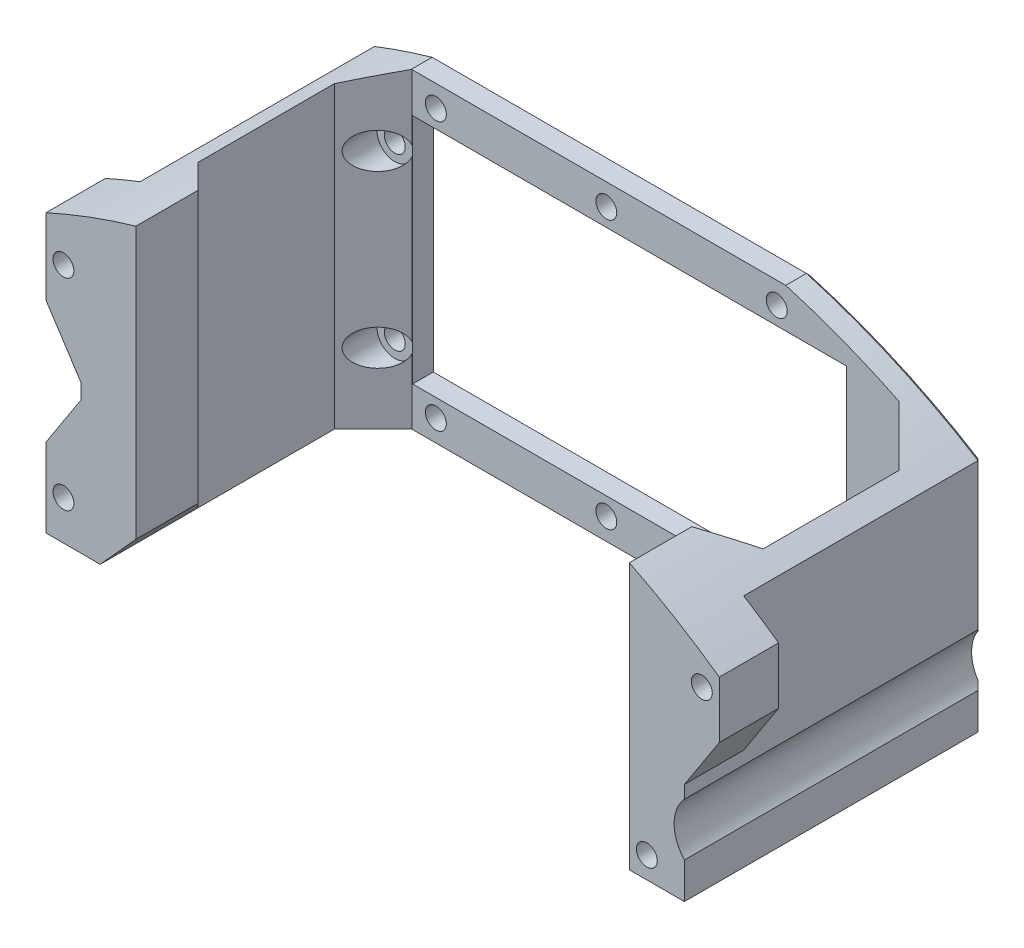
from build123d import *

# Parameters (mm, degrees)
SKETCH1_R           = 1.35
SKETCH1_W           = 56
SKETCH1_H           = 30
BOSS_EXTRUDE1_DEPTH = 3.175
SKETCH2_W           = 2.5
SKETCH2_H           = 40.2
SKETCH2_H_2         = 35.1
BOSS_EXTRUDE2_DEPTH = 27.57
SKETCH3_R           = 1.35
BOSS_EXTRUDE3_DEPTH = 3
CHAMFER1_SIZE       = 0.5
CHAMFER3_SIZE       = 5
SKETCH5_R           = 2.3
CUT_EXTRUDE2_DEPTH  = 7
CHAMFER4_SIZE       = 0.5
CUT_EXTRUDE3_DEPTH  = 33.745
CHAMFER5_SIZE       = 0.5
CHAMFER6_SIZE       = 5
CHAMFER7_SIZE       = 4.545853152
CHAMFER7_SIZE_2     = 7
SKETCH7_R           = 5
CUT_EXTRUDE4_DEPTH  = 64.425350019
CHAMFER8_SIZE       = 7
CHAMFER8_SIZE_2     = 4.545853152
SKETCH9_R           = 2.35
CUT_EXTRUDE5_DEPTH  = 30.745
SKETCH10_R          = 1.35
BOSS_EXTRUDE4_DEPTH = 4.65


# Read off the part's stored shape, not the designer's step: Cut-Extrude3
with BuildPart() as part:
    # Sketch1 → Boss-Extrude1 (new body)
    with BuildSketch(Plane.XY):
        Polygon((33.5, 20.1), (45.3, 15), (45.3, -20.1), (-32.6, -20.1), (-32.6, 20.1), align=None)
        with Locations((22, 17.3)):
            Circle(SKETCH1_R, mode=Mode.SUBTRACT)
        with Locations((0, 17.3)):
            Circle(SKETCH1_R, mode=Mode.SUBTRACT)
        with Locations((-22, 17.3)):
            Circle(SKETCH1_R, mode=Mode.SUBTRACT)
        with Locations((-27.3, 11)):
            Circle(SKETCH1_R, mode=Mode.SUBTRACT)
        with Locations(Location((22, -17.3, 0), (0, 0, 180))):
            Circle(SKETCH1_R, mode=Mode.SUBTRACT)
        with Locations(Location((0, -17.3, 0), (0, 0, 180))):
            Circle(SKETCH1_R, mode=Mode.SUBTRACT)
        with Locations(Location((-22, -17.3, 0), (0, 0, 180))):
            Circle(SKETCH1_R, mode=Mode.SUBTRACT)
        with Locations(Location((-27.3, -11, 0), (0, 0, 180))):
            Circle(SKETCH1_R, mode=Mode.SUBTRACT)
        with Locations((3, 0)):
            Rectangle(SKETCH1_W, SKETCH1_H, mode=Mode.SUBTRACT)
    extrude(amount=BOSS_EXTRUDE1_DEPTH)

    # Sketch2 → Boss-Extrude2 (add)
    with BuildSketch(Plane.XY.offset(3.175)):
        with Locations((-31.35, 0)):
            Rectangle(SKETCH2_W, SKETCH2_H)
        with Locations((44.05, -2.55)):
            Rectangle(SKETCH2_W, SKETCH2_H_2)
    extrude(amount=BOSS_EXTRUDE2_DEPTH)

    # Sketch3 → Boss-Extrude3 (add)
    # profile 1 of 2: a face of its own
    with BuildSketch(Plane.XY.offset(30.745)):
        Polygon((49.8, 0), (45.3, 0), (45.3, -20.1), (38.2, -20.1), (38.2, 15), (49.8, 15), align=None)
        with Locations((47.55, 5)):
            Circle(SKETCH3_R, mode=Mode.SUBTRACT)
        with Locations((40.45, -17.3)):
            Circle(SKETCH3_R, mode=Mode.SUBTRACT)
    # profile 2 of 2: a face of its own
    with BuildSketch(Plane.XY.offset(30.745)):
        Polygon((-25.5, 20.1), (-37.1, 20.1), (-37.1, 6), (-32.6, 6), (-32.6, -10), (-37.1, -10), (-37.1, -20.1), (-30.1, -20.1), (-25.5, -15), align=None)
        with Locations((-34.85, 11)):
            Circle(SKETCH3_R, mode=Mode.SUBTRACT)
        with Locations((-34.85, -15)):
            Circle(SKETCH3_R, mode=Mode.SUBTRACT)
    extrude(amount=BOSS_EXTRUDE3_DEPTH)

    # Chamfer1
    chamfer1_edges = [part.edges().sort_by_distance(p)[0] for p in [
        (3, -15, 0),
        (31, 0, 0),
        (3, 15, 0),
        (-25, 0, 0),
    ]]
    chamfer(chamfer1_edges, length=CHAMFER1_SIZE)

    # Chamfer3
    # the kernel refuses this chamfer: 5 mm, written as the material it adds along each edge
    with BuildSketch(Plane(origin=(-30.1, 20.1, 3.175), x_dir=(0.9996219169112968, 0, -0.027495876610586386), z_dir=(0, -1, 0))) as chamfer3_piece_1_section:
        Polygon((CHAMFER3_SIZE * 0.999621916911, CHAMFER3_SIZE * 0.0274958766106), (-CHAMFER3_SIZE * 0.0274958766106, CHAMFER3_SIZE * 0.999621916911), (0, 0), align=None)
    chamfer3_piece_1 = extrude(amount=40.2, mode=Mode.PRIVATE)
    chamfer3_piece_1 = chamfer3_piece_1 - Plane(origin=(-27.3, -11, 4.84942863), x_dir=(-1, 0, 0), z_dir=(0, 0, -1)) * Cylinder(1.35, 101, mode=Mode.PRIVATE)
    chamfer3_piece_1 = chamfer3_piece_1 - Plane(origin=(-27.3, 11, 4.84942863), x_dir=(1, 0, 0), z_dir=(0, 0, -1)) * Cylinder(1.35, 101, mode=Mode.PRIVATE)
    add(chamfer3_piece_1)
    with BuildSketch(Plane(origin=(42.8, 15, 3.175), x_dir=(-0.9996219169112968, 0, -0.027495876610586403), z_dir=(0, -1, 0))) as chamfer3_piece_2:
        Polygon((CHAMFER3_SIZE * 0.999621916911, -CHAMFER3_SIZE * 0.0274958766106), (-CHAMFER3_SIZE * 0.0274958766106, -CHAMFER3_SIZE * 0.999621916911), (0, 0), align=None)
    extrude(amount=35.1)

    # Sketch5 → Cut-Extrude2 (cut)
    with BuildSketch(Plane.XY.offset(3.175)):
        with Locations((-27.3, 11)):
            Circle(SKETCH5_R)
        with Locations((-27.3, -11)):
            Circle(SKETCH5_R)
    extrude(amount=CUT_EXTRUDE2_DEPTH, mode=Mode.SUBTRACT)

    # Chamfer4
    chamfer4_edges = [part.edges().sort_by_distance(p)[0] for p in [
        (41.55, 15, 3.175),
    ]]
    chamfer(chamfer4_edges, length=CHAMFER4_SIZE)

    # Cut-Extrude3 outline → Cut-Extrude3 (cut)
    with BuildSketch(Plane.XY):
        with BuildLine():
            Line((33.5, 20.1), (23.154502686, 20.1))
            ThreePointArc((23.154502686, 20.1), (37.024570378, 14.805977232), (49.8, 7.243315476))
            Line((49.8, 7.243315476), (49.8, 15))
            Line((49.8, 15), (45.3, 15))
            Line((45.3, 15), (33.5, 20.1))
        make_face()
        with BuildLine():
            ThreePointArc((-37.1, 15.705959627), (-31.207253619, 18.120471436), (-25.154502686, 20.1))
            Line((-25.154502686, 20.1), (-37.1, 20.1))
            Line((-37.1, 20.1), (-37.1, 15.705959627))
        make_face()
    extrude(amount=CUT_EXTRUDE3_DEPTH, mode=Mode.SUBTRACT)

    # Chamfer5
    chamfer5_edges = [part.edges().sort_by_distance(p)[0] for p in [
        (-1, 20.1, 0),
        (-32.6, -1.252665528, 0),
        (34.570093208, 15.943845724, 0),
        (-28.905381441, 18.930933232, 0),
        (45.3, -4.926691958, 0),
    ]]
    chamfer(chamfer5_edges, length=CHAMFER5_SIZE)

    # Chamfer6
    # the kernel refuses this chamfer: 5 mm, written as the material it adds along each edge
    with BuildSketch(Plane(origin=(-30.1, 31.377746009, 30.745), x_dir=(-0.027495876610586317, 0, -0.9996219169112968), z_dir=(0, -1, 0))) as chamfer6_piece_1_section:
        Polygon((CHAMFER6_SIZE * 0.999621916911, CHAMFER6_SIZE * 0.0274958766106), (-CHAMFER6_SIZE * 0.0274958766106, CHAMFER6_SIZE * 0.999621916911), (0, 0), align=None)
    chamfer6_piece_1 = extrude(amount=51.477746009, mode=Mode.PRIVATE)
    chamfer6_piece_1 = split(chamfer6_piece_1, bisect_by=Plane(origin=(-19.223588123, -8.041369441, 29.056632275), z_dir=(-0.7425697235686511, 0.6697687702776064, 0)), keep=Keep.TOP, mode=Mode.PRIVATE)
    chamfer6_piece_1 = chamfer6_piece_1 & Plane(origin=(-1.000000031, -63.999999922, 29.056632275), x_dir=(-0.4125714286119157, 0.9109252528572929, 0), z_dir=(0, 0, -1)) * Cylinder(87.499999916, 123, mode=Mode.PRIVATE)
    chamfer6_piece_1 = split(chamfer6_piece_1, bisect_by=Plane(origin=(-25.5, 0.348686726, 29.056632275), z_dir=(-1, 0, 0)), keep=Keep.TOP, mode=Mode.PRIVATE)
    add(chamfer6_piece_1)
    with BuildSketch(Plane(origin=(42.8, 24.606748254, 30.745), x_dir=(-0.9996219169112968, 0, 0.027495876610586317), z_dir=(0, -1, 0))) as chamfer6_piece_2_section:
        Polygon((CHAMFER6_SIZE * 0.999621916911, CHAMFER6_SIZE * 0.0274958766106), (-CHAMFER6_SIZE * 0.0274958766106, CHAMFER6_SIZE * 0.999621916911), (0, 0), align=None)
    chamfer6_piece_2 = extrude(amount=44.706748254, mode=Mode.PRIVATE)
    chamfer6_piece_2 = split(chamfer6_piece_2, bisect_by=Plane(origin=(38.2, -3.223741297, 29.074949458), z_dir=(1, 0, 0)), keep=Keep.TOP, mode=Mode.PRIVATE)
    chamfer6_piece_2 = chamfer6_piece_2 & Plane(origin=(-1.000000015, -64.000000032, 29.074949458), x_dir=(0.2760514593327394, 0.9611428571238851, 0), z_dir=(0, 0, -1)) * Cylinder(87.500000035, 110, mode=Mode.PRIVATE)
    chamfer6_piece_2 = chamfer6_piece_2 - Plane(origin=(40.45, -17.3, 29.074949458), x_dir=(1, 0, 0), z_dir=(0, 0, -1)) * Cylinder(1.35, 110, mode=Mode.PRIVATE)
    add(chamfer6_piece_2)

    # Chamfer7
    # the kernel refuses this chamfer: 7, 4.545853152 mm, written as the material it adds along each edge
    with BuildSketch(Plane(origin=(45.3, 0, 30.745), x_dir=(0.9987532912567346, 0.049918565722988334, 0), z_dir=(0, 0, 1))) as chamfer7_piece_1_section:
        Polygon((CHAMFER7_SIZE * 0.998753291341, -CHAMFER7_SIZE * 0.0499185657272), (-CHAMFER7_SIZE_2 * 0.049918565723, -CHAMFER7_SIZE_2 * 0.998753291257), (0, 0), align=None)
    chamfer7_piece_1 = extrude(amount=3, mode=Mode.PRIVATE)
    chamfer7_piece_1 = split(chamfer7_piece_1, bisect_by=Plane(origin=(49.8, -2.345805882, 32.245), z_dir=(-1, 0, 0)), keep=Keep.TOP, mode=Mode.PRIVATE)
    add(chamfer7_piece_1)

    # Sketch7 → Cut-Extrude4 (cut, through all)
    with BuildSketch(Plane(origin=(0, 0, 0), x_dir=(-1, 0, 0), z_dir=(0, 0, -1))):
        with Locations((-48.97, -12.05)):
            Circle(SKETCH7_R)
    extrude(amount=-CUT_EXTRUDE4_DEPTH, mode=Mode.SUBTRACT)

    # Chamfer8
    # the kernel refuses this chamfer: 7, 4.545853152 mm, written as the material it adds along each edge
    with BuildSketch(Plane(origin=(-32.6, -10, 30.745), x_dir=(0.02107376546627368, 0.9997779235455605, 0), z_dir=(0, 0, 1))) as chamfer8_piece_1_section:
        Polygon((CHAMFER8_SIZE * 0.999777923546, CHAMFER8_SIZE * 0.0210737654663), (-CHAMFER8_SIZE_2 * 0.021073765468, CHAMFER8_SIZE_2 * 0.99977792363), (0, 0), align=None)
    chamfer8_piece_1 = extrude(amount=3, mode=Mode.PRIVATE)
    chamfer8_piece_1 = split(chamfer8_piece_1, bisect_by=Plane(origin=(-37.1, -7.654194118, 32.245), z_dir=(1, 0, 0)), keep=Keep.TOP, mode=Mode.PRIVATE)
    add(chamfer8_piece_1)
    with BuildSketch(Plane(origin=(-32.6, 6, 30.745), x_dir=(-0.9987532912567346, 0.049918565722988396, 0), z_dir=(0, 0, 1))) as chamfer8_piece_2_section:
        Polygon((CHAMFER8_SIZE_2 * 0.998753291341, CHAMFER8_SIZE_2 * 0.0499185657272), (-CHAMFER8_SIZE * 0.049918565723, CHAMFER8_SIZE * 0.998753291257), (0, 0), align=None)
    chamfer8_piece_2 = extrude(amount=3, mode=Mode.PRIVATE)
    chamfer8_piece_2 = split(chamfer8_piece_2, bisect_by=Plane(origin=(-37.1, 3.654194118, 32.245), z_dir=(1, 0, 0)), keep=Keep.TOP, mode=Mode.PRIVATE)
    add(chamfer8_piece_2)

    # Sketch9 → Cut-Extrude5 (cut)
    with BuildSketch(Plane.XY):
        with Locations((40.45, -17.3)):
            Circle(SKETCH9_R)
    extrude(amount=CUT_EXTRUDE5_DEPTH, mode=Mode.SUBTRACT)

    # Sketch10 → Boss-Extrude4 (add)
    # profile 1 of 2: a face of its own
    with BuildSketch(Plane.XY.offset(33.745)):
        with BuildLine():
            Line((45.3, -20.1), (45.3, -15.44574734))
            ThreePointArc((45.3, -15.44574734), (43.97, -12.05), (45.3, -8.65425266))
            Line((45.3, -8.65425266), (45.3, -7))
            Line((45.3, -7), (49.8, -0.070607663))
            Line((49.8, -0.070607663), (49.8, 7.243315476))
            ThreePointArc((49.8, 7.243315476), (44.135310253, 10.960347974), (38.2, 14.227936187))
            Line((38.2, 14.227936187), (38.2, -20.1))
            Line((38.2, -20.1), (45.3, -20.1))
        make_face()
        with Locations((47.55, 5)):
            Circle(SKETCH10_R, mode=Mode.SUBTRACT)
        with Locations((40.45, -17.3)):
            Circle(SKETCH10_R, mode=Mode.SUBTRACT)
    # profile 2 of 2: a face of its own
    with BuildSketch(Plane.XY.offset(33.745)):
        with BuildLine():
            Line((-25.5, -15), (-25.5, 20))
            ThreePointArc((-25.5, 20), (-31.375972341, 18.0582129), (-37.1, 15.705959627))
            Line((-37.1, 15.705959627), (-37.1, 5.929392337))
            Line((-37.1, 5.929392337), (-32.6, -1))
            Line((-32.6, -1), (-32.6, -3))
            Line((-32.6, -3), (-37.1, -9.929392337))
            Line((-37.1, -9.929392337), (-37.1, -20.1))
            Line((-37.1, -20.1), (-30.1, -20.1))
            Line((-30.1, -20.1), (-25.5, -15))
        make_face()
        with Locations((-34.85, 11)):
            Circle(SKETCH10_R, mode=Mode.SUBTRACT)
        with Locations((-34.85, -15)):
            Circle(SKETCH10_R, mode=Mode.SUBTRACT)
    extrude(amount=BOSS_EXTRUDE4_DEPTH)


solid = part.part
